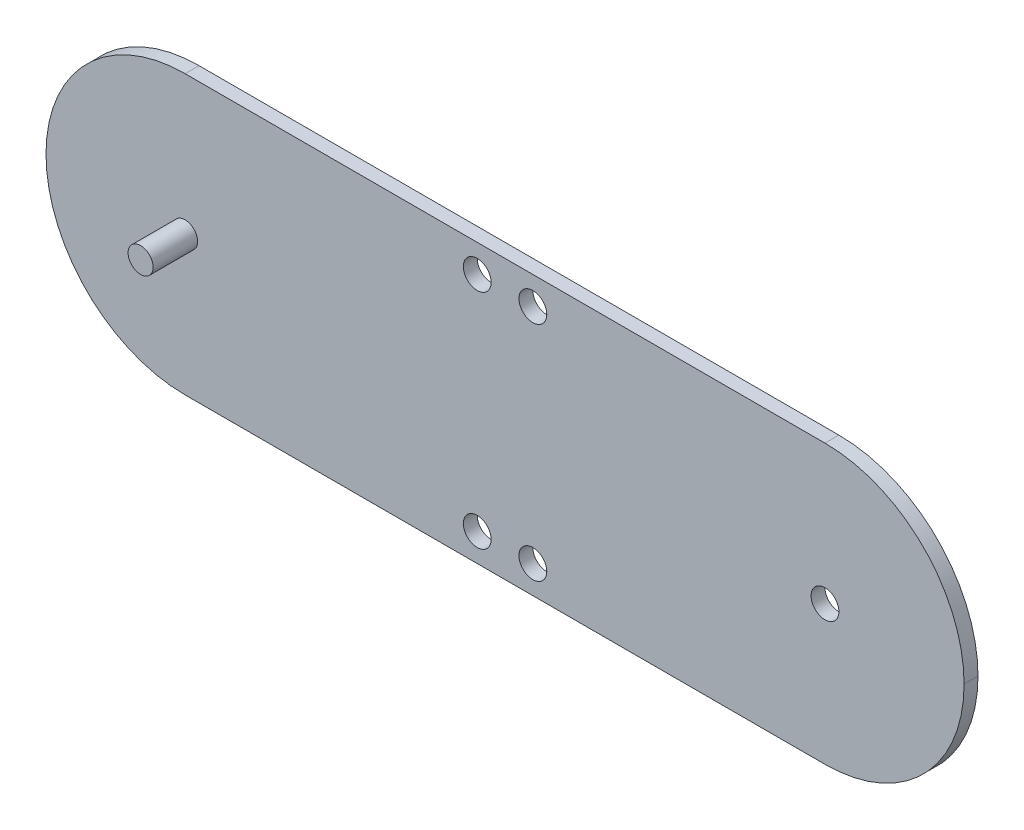
from build123d import *

# Parameters (mm, degrees)
SKETCH1_W           = 165
SKETCH1_H           = 50
BOSS_EXTRUDE1_DEPTH = 2.5
FILLET1_R           = 25
SKETCH2_R           = 2.5
CUT_EXTRUDE1_DEPTH  = 2.5
SKETCH3_R           = 2.5
CUT_EXTRUDE2_DEPTH  = 2.5
SKETCH4_R           = 2.25
BOSS_EXTRUDE2_DEPTH = 8


with BuildPart() as part:
    # Sketch1 → Boss-Extrude1 (new body)
    with BuildSketch(Plane.XY):
        Rectangle(SKETCH1_W, SKETCH1_H)
    extrude(amount=BOSS_EXTRUDE1_DEPTH)

    # Fillet1
    fillet1_edges = [part.edges().sort_by_distance(p)[0] for p in [
        (-82.5, -25, 1.25),
        (-82.5, 25, 1.25),
        (82.5, -25, 1.25),
        (82.5, 25, 1.25),
    ]]
    fillet(fillet1_edges, radius=FILLET1_R - 0.0001)  # a hair under: the kernel refuses the full size

    # Sketch2 → Cut-Extrude1 (cut)
    with BuildSketch(Plane.XY.offset(2.5)):
        with Locations((-5, 20)):
            Circle(SKETCH2_R)
        with Locations((5, 20)):
            Circle(SKETCH2_R)
    cut_extrude1 = extrude(amount=-CUT_EXTRUDE1_DEPTH, mode=Mode.SUBTRACT)

    # Mirror1: Cut-Extrude1 across plane
    add(cut_extrude1.mirror(Plane.ZX), mode=Mode.SUBTRACT)

    # Sketch3 → Cut-Extrude2 (cut)
    with BuildSketch(Plane(origin=(0, 0, 0), x_dir=(-1, 0, 0), z_dir=(0, 0, -1))):
        with Locations((-57.5, 0)):
            Circle(SKETCH3_R)
    extrude(amount=-CUT_EXTRUDE2_DEPTH, mode=Mode.SUBTRACT)

    # Sketch4 → Boss-Extrude2 (add)
    with BuildSketch(Plane.XY.offset(2.5)):
        with Locations(Location((-57.5, 0, 0), (0, 0, 180))):
            Circle(SKETCH4_R)
    extrude(amount=BOSS_EXTRUDE2_DEPTH)


solid = part.part
